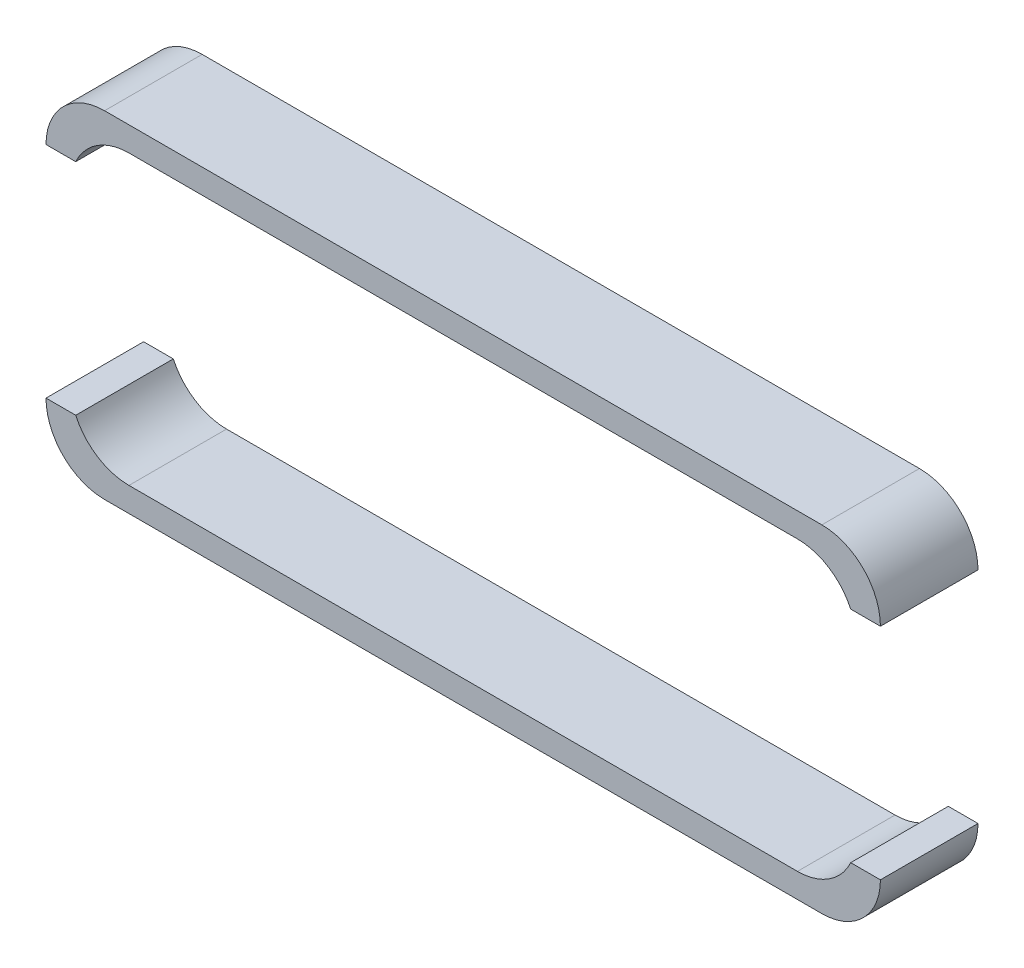
from build123d import *

# Parameters (mm, degrees)
ESQUISSE1_W             = 85.5
ESQUISSE1_H             = 34.5
ESQUISSE1_W_2           = 80.5
ESQUISSE1_H_2           = 29.5
BOSS_EXTRU_1_DEPTH      = 10
CONG_1_R                = 6
CONG_2_R                = 6
ESQUISSE3_W             = 10
ESQUISSE3_H             = 22.5
ENL_V_MAT_EXTRU_1_DEPTH = 92.838172891


with BuildPart() as part:
    # Esquisse1 → Boss.-Extru.1 (new body)
    with BuildSketch(Plane.XY):
        with Locations((40.25, 14.75)):
            Rectangle(ESQUISSE1_W, ESQUISSE1_H)
        with Locations((40.25, 14.75)):
            Rectangle(ESQUISSE1_W_2, ESQUISSE1_H_2, mode=Mode.SUBTRACT)
    extrude(amount=BOSS_EXTRU_1_DEPTH)

    # Congé1
    cong_1_edges = [part.edges().sort_by_distance(p)[0] for p in [
        (80.5, 0, 5),
        (80.5, 29.5, 5),
        (0, 0, 5),
        (0, 29.5, 5),
    ]]
    fillet(cong_1_edges, radius=CONG_1_R)

    # Congé2
    cong_2_edges = [part.edges().sort_by_distance(p)[0] for p in [
        (83, 32, 5),
        (83, -2.5, 5),
        (-2.5, -2.5, 5),
        (-2.5, 32, 5),
    ]]
    fillet(cong_2_edges, radius=CONG_2_R)

    # Esquisse3 → Enlèv. mat.-Extru.1 (cut, through all)
    with BuildSketch(Plane(origin=(83, 0, 0), x_dir=(0, 0, -1), z_dir=(1, 0, 0))):
        with Locations((-5, 14.75)):
            Rectangle(ESQUISSE3_W, ESQUISSE3_H)
    extrude(amount=-ENL_V_MAT_EXTRU_1_DEPTH, mode=Mode.SUBTRACT)


with BuildPart() as enl_v_mat_extru_1_piece_1:
    # of the separate pieces the step leaves, piece 1, a body of its own (enl_v_mat_extru_1_pieces)
    add(part.part.solids().sort_by_distance((3.5, 32, 0))[0])


with BuildPart() as enl_v_mat_extru_1_piece_2:
    # of the separate pieces the step leaves, piece 2, a body of its own (enl_v_mat_extru_1_pieces)
    add(part.part.solids().sort_by_distance((3.5, -2.5, 0))[0])


solid = Compound([enl_v_mat_extru_1_piece_1.part, enl_v_mat_extru_1_piece_2.part])
